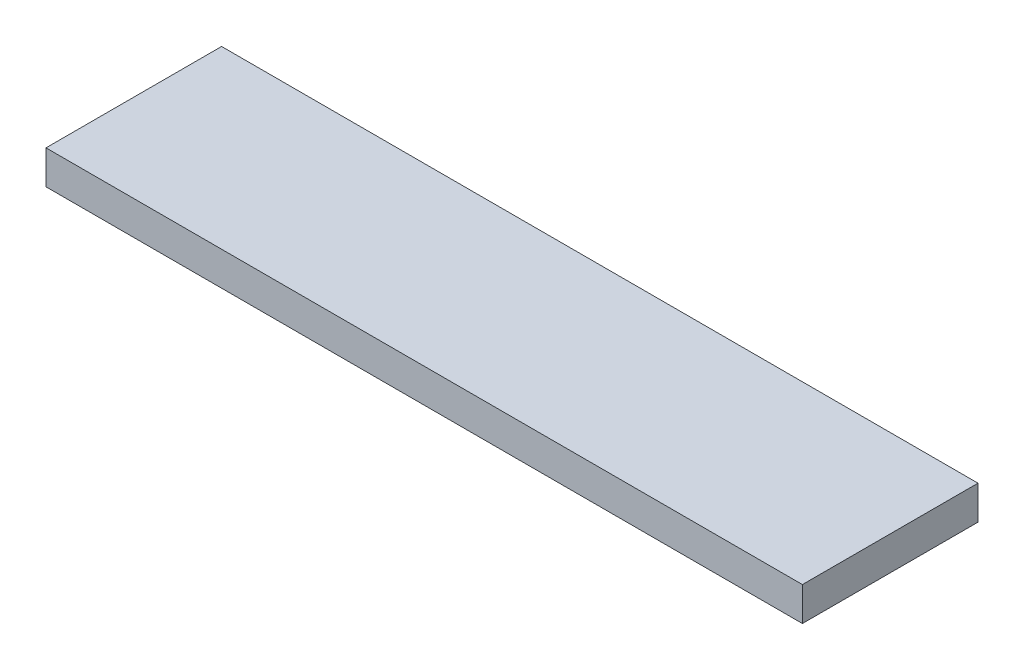
from build123d import *

# Parameters (mm, degrees)
SKETCH_1_W      = 224
SKETCH_1_H      = 52
EXTRUDE_1_DEPTH = 10


with BuildPart() as part:
    # 草图1 → 凸台-拉伸1 (new body)
    with BuildSketch(Plane(origin=(0, 0, 0), x_dir=(1, 0, 0), z_dir=(0, 1, 0))):
        with Locations((112, -26)):
            Rectangle(SKETCH_1_W, SKETCH_1_H)
    extrude(amount=EXTRUDE_1_DEPTH)


solid = part.part
